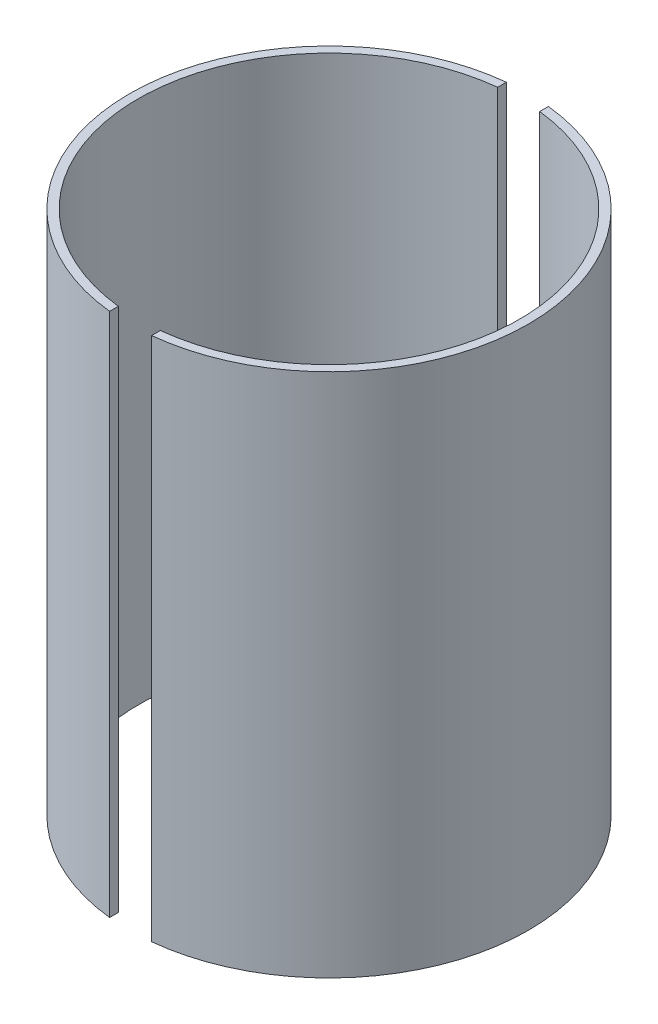
from build123d import *

# Parameters (mm, degrees)
ESQUISSE1_R             = 76
ESQUISSE1_R_2           = 72.7
BOSS_EXTRU_1_DEPTH      = 200
ESQUISSE2_W             = 16
ESQUISSE2_H             = 207.49820715
ENL_V_MAT_EXTRU_1_DEPTH = 228.050655141


with BuildPart() as part:
    # Esquisse1 → Boss.-Extru.1 (new body)
    with BuildSketch(Plane(origin=(0, 0, 0), x_dir=(1, 0, 0), z_dir=(0, 1, 0))):
        Circle(ESQUISSE1_R)
        Circle(ESQUISSE1_R_2, mode=Mode.SUBTRACT)
    extrude(amount=BOSS_EXTRU_1_DEPTH)

    # Esquisse2 → Enlèv. mat.-Extru.1 (cut, through all)
    with BuildSketch(Plane.XZ):
        with Locations((0, 22.122568389)):
            Rectangle(ESQUISSE2_W, ESQUISSE2_H)
    extrude(amount=-ENL_V_MAT_EXTRU_1_DEPTH, mode=Mode.SUBTRACT)


with BuildPart() as enl_v_mat_extru_1_piece_1:
    # of the separate pieces the step leaves, piece 1, a body of its own (enl_v_mat_extru_1_pieces)
    add(part.part.solids().sort_by_distance((-8, 0, -75.577774511))[0])


with BuildPart() as enl_v_mat_extru_1_piece_2:
    # of the separate pieces the step leaves, piece 2, a body of its own (enl_v_mat_extru_1_pieces)
    add(part.part.solids().sort_by_distance((8, 0, 75.577774511))[0])


solid = Compound([enl_v_mat_extru_1_piece_1.part, enl_v_mat_extru_1_piece_2.part])
